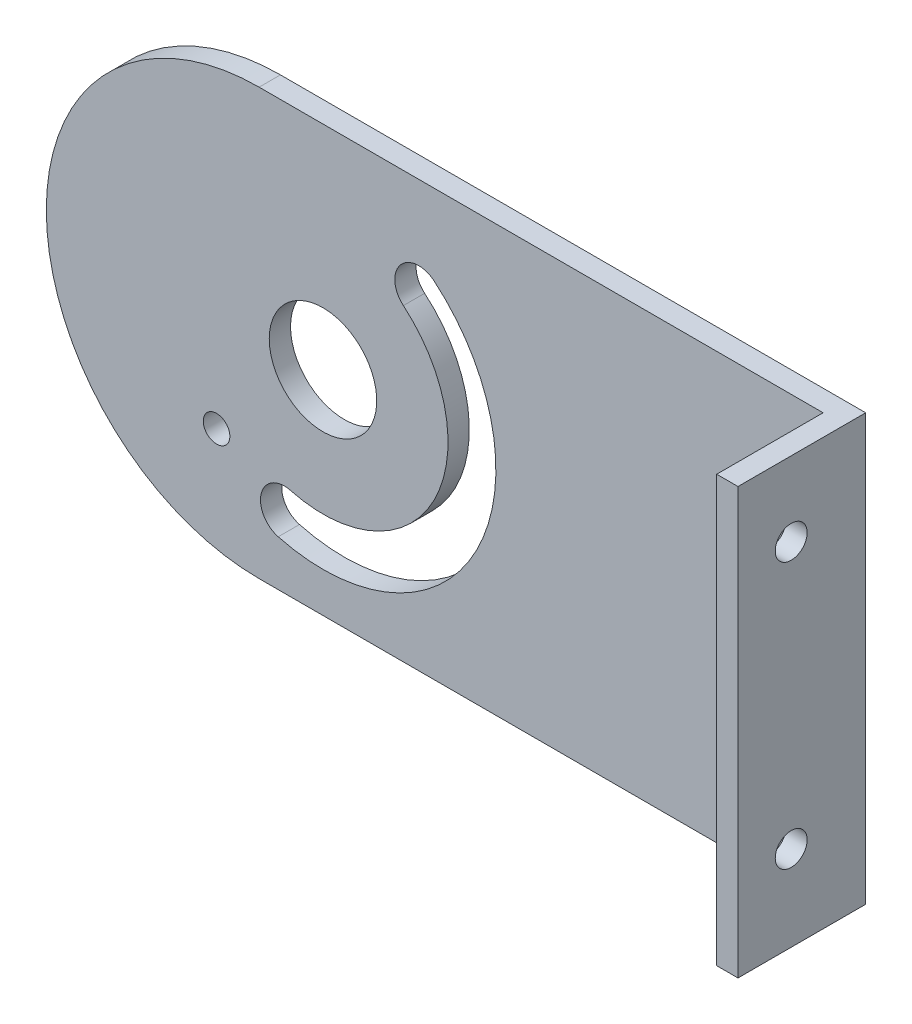
from build123d import *

# Parameters (mm, degrees)
SKETCH_2_W          = 75
SKETCH_2_H          = 40
EXTRUDE_1_DEPTH     = 2
SKETCH_3_R          = 5.05
SKETCH_3_R_2        = 1.25
CUT_EXTRUDE_1_DEPTH = 86.023526156
FILLET_1_R          = 20
SKETCH_7_W          = 2
SKETCH_7_H          = 40
EXTRUDE_3_DEPTH     = 12
SKETCH_8_R          = 1.5
CUT_EXTRUDE_2_DEPTH = 10


with BuildPart() as part:
    # 草图2 → 凸台-拉伸1 (new body)
    with BuildSketch(Plane.XY):
        with Locations((37.5, 20)):
            Rectangle(SKETCH_2_W, SKETCH_2_H)
    extrude(amount=EXTRUDE_1_DEPTH)

    # 草图3 → 切除-拉伸1 (cut, through all)
    with BuildSketch(Plane(origin=(0, 0, 0), x_dir=(-1, 0, 0), z_dir=(0, 0, -1))):
        with Locations((-26, 20)):
            Circle(SKETCH_3_R)
        with Locations((-16, 10.202041029)):
            Circle(SKETCH_3_R_2)
        with BuildLine():
            ThreePointArc((-36.446428571, 32.447274003), (-40.413244876, 12.495276677), (-21.792765741, 4.30408716))
            ThreePointArc((-21.792765741, 4.30408716), (-20.20202563, 7.059907527), (-22.957845998, 8.650647638))
            ThreePointArc((-22.957845998, 8.650647638), (-36.421884756, 14.573507751), (-33.553571429, 29.000336587))
            ThreePointArc((-33.553571429, 29.000336587), (-33.276531292, 32.170233866), (-36.446428571, 32.447274003))
        make_face()
    extrude(amount=-CUT_EXTRUDE_1_DEPTH, mode=Mode.SUBTRACT)

    # 圆角1
    fillet_1_edges = [part.edges().sort_by_distance(p)[0] for p in [
        (0, 40, 1),
        (0, 0, 1),
    ]]
    fillet(fillet_1_edges, radius=FILLET_1_R - 0.0001)  # a hair under: the kernel refuses the full size

    # 草图7 → 凸台-拉伸3 (add)
    with BuildSketch(Plane(origin=(0, 0, 0), x_dir=(-1, 0, 0), z_dir=(0, 0, -1))):
        with Locations((-74, 20)):
            Rectangle(SKETCH_7_W, SKETCH_7_H)
    extrude(amount=-EXTRUDE_3_DEPTH)

    # 草图8 → 切除-拉伸2 (cut)
    with BuildSketch(Plane.ZY.offset(-73)):
        with Locations((7, 33)):
            Circle(SKETCH_8_R)
        with Locations((7, 8)):
            Circle(SKETCH_8_R)
    extrude(amount=-CUT_EXTRUDE_2_DEPTH, mode=Mode.SUBTRACT)


solid = part.part
